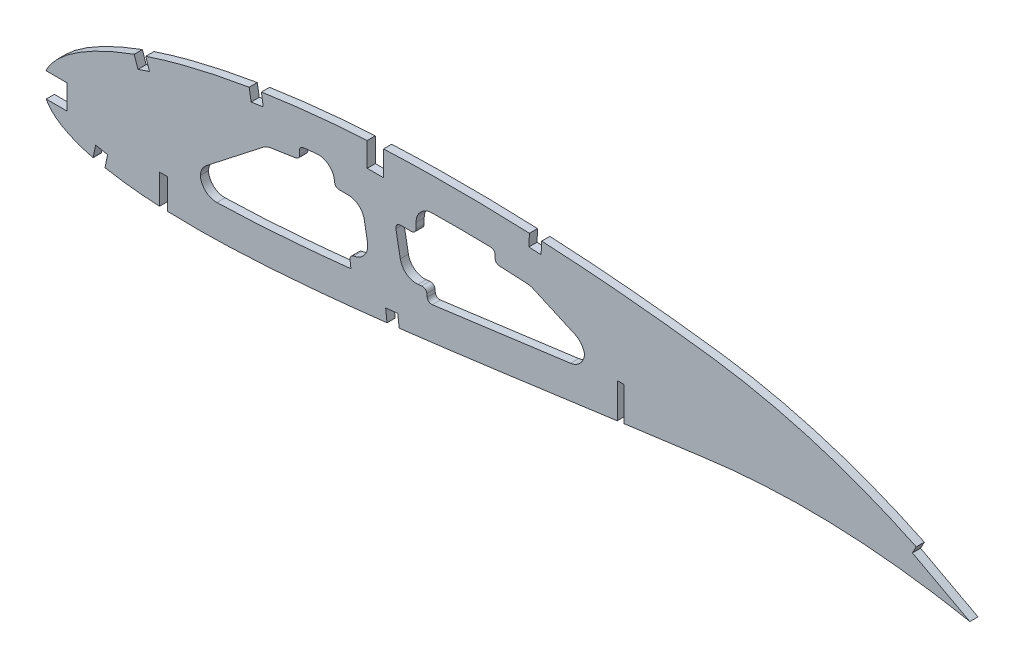
from build123d import *

# Parameters (mm, degrees)
BOSS_EXTRUDE1_DEPTH = 3.175
CUT_EXTRUDE1_DEPTH  = 7.62
SKETCH3_W           = 9.525
SKETCH3_H           = 9.525
CUT_EXTRUDE2_DEPTH  = 7.62
CUT_EXTRUDE3_DEPTH  = 7.62
FILLET1_R           = 6.35
FILLET2_R           = 1.778
CUT_EXTRUDE4_DEPTH  = 374.229172675


with BuildPart() as part:
    # Sketch1 → Boss-Extrude1 (new body)
    with BuildSketch(Plane.XY):
        with BuildLine():
            Line((366.779221984, -0.572532859), (370.310025602, -1.32569148))
            Line((370.310025602, -1.32569148), (367.237248504, 0.572532859))
            add(Edge.make_bspline(
                [(367.237248504, 0.572532859), (367.209115751, 0.589912016), (367.096693954, 0.659361177), (366.843387397, 0.814735964), (366.421579402, 1.073520617), (365.831084917, 1.43391727), (365.072362673, 1.894969327), (364.145030833, 2.453448145), (363.049668235, 3.107539147), (361.78654025, 3.854149183), (360.355776171, 4.689782048), (358.757920825, 5.61105264), (356.993113179, 6.61274511), (355.06203687, 7.690766613), (352.96535437, 8.839989942), (350.703462511, 10.055224806), (348.277171256, 11.330289826), (345.687411743, 12.659700467), (342.934656313, 14.036115757), (340.020202795, 15.453807339), (336.945022097, 16.905706333), (333.710163942, 18.384066929), (330.317486658, 19.882862373), (326.767928213, 21.392774778), (323.06351151, 22.907262237), (319.205813659, 24.417705773), (315.197118609, 25.917225993), (311.038972972, 27.396108947), (306.73448515, 28.847891701), (302.285743308, 30.263143128), (297.695928748, 31.634176974), (292.967708233, 32.952104115), (288.10502333, 34.210165552), (283.11095799, 35.399199558), (277.989744959, 36.511247133), (272.745455003, 37.539613083), (267.382486443, 38.474030655), (261.915700498, 39.313771303), (256.433056518, 40.012293244), (250.961692668, 40.697383276), (245.498477017, 41.34096267), (239.968489428, 41.957278945), (234.377050063, 42.54286215), (228.729705217, 43.095881158), (223.032171983, 43.613949148), (217.290371144, 44.095546934), (211.509858724, 44.537945534), (205.696729956, 44.940463429), (199.8567319, 45.299561873), (193.996084852, 45.614971395), (188.120738144, 45.884492116), (182.236806039, 46.106266996), (176.350536437, 46.278957311), (170.468039484, 46.400908527), (164.595684421, 46.47135392), (158.739579431, 46.488368695), (152.90609078, 46.451648421), (147.101327081, 46.35993231), (141.331661108, 46.21196474), (135.603209819, 46.00746964), (129.92216764, 45.746535631), (124.294754737, 45.426977601), (118.727075839, 45.050831997), (113.22533102, 44.616518763), (107.79556513, 44.123922344), (102.443468619, 43.575096068), (97.175000212, 42.968547242), (91.995806101, 42.306001647), (86.911551284, 41.588758347), (81.927940427, 40.816426555), (77.050312099, 39.991237197), (72.283930644, 39.114034533), (67.633838897, 38.187390229), (63.105099551, 37.211546097), (58.702506527, 36.189429331), (54.430635268, 35.12282073), (50.29407794, 34.013672938), (46.297027813, 32.864647422), (42.443526778, 31.678350961), (38.73806709, 30.456087063), (35.183449271, 29.20248999), (31.784039791, 27.918449689), (28.542442713, 26.607921896), (25.46245696, 25.272695966), (22.546383362, 23.916842473), (19.79752229, 22.541904914), (17.217832841, 21.151735431), (14.809904809, 19.748465709), (12.576056134, 18.334702116), (10.517225629, 16.914030851), (8.636251908, 15.487343527), (6.933781057, 14.058245411), (5.410890546, 12.628912534), (4.069757076, 11.200329631), (2.910332492, 9.775012337), (1.93413617, 8.354089532), (1.141337537, 6.938905699), (0.533729736, 5.530488873), (0.110710257, 4.129631103), (-0.120847754, 2.738400014), (-0.178483964, 1.355680289), (-0.059405759, 0.451218221), (0, 0)],
                knots=[0, 0, 0, 0, 0.00025409, 0.001015374, 0.002283359, 0.004056577, 0.006330982, 0.009105274, 0.01237449, 0.016134024, 0.020379661, 0.025105976, 0.030306237, 0.035972206, 0.042099523, 0.048678064, 0.055701664, 0.063160184, 0.071045824, 0.079349827, 0.08806291, 0.097175757, 0.106678112, 0.116561573, 0.126814276, 0.1374283, 0.148393618, 0.15969976, 0.171338126, 0.183297699, 0.195569604, 0.208143556, 0.221011594, 0.234161831, 0.247587451, 0.261276823, 0.27522271, 0.289414144, 0.3037712, 0.317689227, 0.331784111, 0.346039677, 0.36044387, 0.374982721, 0.389640455, 0.404403317, 0.419256601, 0.43418675, 0.449177265, 0.464214782, 0.479284009, 0.49436974, 0.509457833, 0.524532346, 0.53957932, 0.554582984, 0.569529546, 0.584403417, 0.599190992, 0.613876838, 0.628447475, 0.642888675, 0.657186054, 0.671325546, 0.685294014, 0.699078148, 0.712665095, 0.726042645, 0.739197713, 0.752117587, 0.764792042, 0.777208152, 0.789355685, 0.80122396, 0.812803686, 0.824082909, 0.835054602, 0.845709571, 0.856037853, 0.866033835, 0.875688843, 0.884997719, 0.893953426, 0.902552897, 0.910789386, 0.918660734, 0.926166253, 0.933302626, 0.94007122, 0.94647478, 0.952517526, 0.958204819, 0.963546652, 0.9685566, 0.973249913, 0.977651041, 0.981787043, 0.985694226, 0.989415109, 0.993001157, 0.996508416, 1, 1, 1, 1], degree=3))
            add(Edge.make_bspline(
                [(0, 0), (0.094305225, -0.445183561), (0.283349084, -1.337596664), (0.796956591, -2.622301778), (1.476177967, -3.857275533), (2.335268581, -5.03923752), (3.368516216, -6.167864763), (4.573638936, -7.244331071), (5.949454767, -8.268057766), (7.494163107, -9.238578843), (9.205519965, -10.156924625), (11.08160183, -11.022524069), (13.120698043, -11.835106765), (15.320587008, -12.593586411), (17.678579271, -13.299118217), (20.19243298, -13.949982821), (22.859289626, -14.547089925), (25.676584203, -15.088915361), (28.641246729, -15.576009603), (31.750197347, -16.008099996), (35.00024492, -16.385456897), (38.388200927, -16.707288362), (41.910714326, -16.9742867), (45.564274184, -17.18662904), (49.34533406, -17.344988676), (53.250272092, -17.448763617), (57.275263844, -17.499571714), (61.416671846, -17.498175704), (65.670444823, -17.444202264), (70.032949035, -17.340633073), (74.49999818, -17.186812008), (79.067559409, -16.984600621), (83.731512725, -16.736033793), (88.487675073, -16.441954217), (93.331860865, -16.103665214), (98.259864016, -15.723879754), (103.267207887, -15.30354505), (108.349525408, -14.845111196), (113.502317177, -14.350873178), (118.721131264, -13.822395178), (124.001361141, -13.262163166), (129.338303799, -12.671992621), (134.727419145, -12.055032062), (140.163784234, -11.412397718), (145.642802026, -10.74775877), (151.159318159, -10.062385108), (156.708719705, -9.358916499), (162.286015513, -8.640665313), (167.885984275, -7.907549552), (173.503916032, -7.164792444), (179.134393031, -6.4117822), (184.772514322, -5.652391584), (190.413060751, -4.888980999), (196.050538376, -4.121785421), (201.679991678, -3.353984297), (207.296198332, -2.587685341), (212.893657193, -1.822958656), (218.467304002, -1.063605171), (224.011526297, -0.309532116), (229.521211727, 0.437731721), (234.99108049, 1.175955737), (240.415971972, 1.904208342), (245.79029012, 2.622028682), (251.108627927, 3.329686337), (256.286014622, 4.005702206), (261.308921574, 4.686074193), (266.194275064, 5.243828548), (271.018799677, 5.719891856), (275.78750695, 6.110198164), (280.494670713, 6.420362635), (285.134897569, 6.652601616), (289.702657326, 6.810157431), (294.192180199, 6.897704202), (298.597858723, 6.917463603), (302.913679308, 6.875737092), (307.134028762, 6.775888132), (311.253016964, 6.622398487), (315.264897433, 6.420446666), (319.163971775, 6.175537915), (322.944386272, 5.891284948), (326.600873145, 5.574323732), (330.127790902, 5.229294225), (333.519723856, 4.860138451), (336.771722702, 4.474591735), (339.878582354, 4.075192399), (342.835629531, 3.668504141), (345.638104292, 3.258648226), (348.281568103, 2.850857356), (350.76186785, 2.449021765), (353.074996968, 2.058474907), (355.217332046, 1.682865683), (357.185155535, 1.3258622), (358.975737519, 0.991968888), (360.585541683, 0.682844304), (362.012414965, 0.403582965), (363.253704214, 0.155417071), (364.307589717, -0.058157081), (365.172231074, -0.236296472), (365.846315097, -0.376076876), (366.328510303, -0.477721618), (366.618295084, -0.538205409), (366.747050131, -0.565670254), (366.779221984, -0.572532859)],
                knots=[0, 0, 0, 0, 0.003638255, 0.007293231, 0.011028136, 0.014901081, 0.018963272, 0.023258475, 0.027820626, 0.032679082, 0.03785316, 0.043361875, 0.049214679, 0.055422346, 0.061988786, 0.068918036, 0.076211157, 0.083868392, 0.091887411, 0.100265912, 0.108999867, 0.11808453, 0.127514843, 0.13728527, 0.147387918, 0.157816481, 0.168563473, 0.179619128, 0.190977373, 0.202626974, 0.214560478, 0.226767249, 0.239236417, 0.251959004, 0.264923895, 0.278119703, 0.291536035, 0.30516028, 0.318980685, 0.332985499, 0.347162791, 0.361498603, 0.375980747, 0.390597192, 0.405332594, 0.420174823, 0.435109533, 0.450124276, 0.465203068, 0.480333154, 0.495500583, 0.510689775, 0.525887335, 0.541078314, 0.556247233, 0.571381785, 0.586466041, 0.601484516, 0.616424329, 0.631269423, 0.646006524, 0.660620684, 0.675098187, 0.689422858, 0.703581825, 0.716907564, 0.730009274, 0.742952128, 0.755725558, 0.768319952, 0.780724338, 0.792926529, 0.804916041, 0.816679084, 0.828203524, 0.839474901, 0.850481359, 0.861207697, 0.871639326, 0.881763414, 0.891563605, 0.901027365, 0.910138977, 0.918883977, 0.927249278, 0.935221104, 0.942784739, 0.949928188, 0.956638465, 0.962904204, 0.968712288, 0.974054485, 0.978918432, 0.983297218, 0.987180246, 0.990560675, 0.993433358, 0.995790626, 0.997629588, 0.998945816, 0.999736593, 1, 1, 1, 1], degree=3))
        make_face()
    extrude(amount=BOSS_EXTRUDE1_DEPTH)

    # Sketch2 → Cut-Extrude1 (cut)
    with BuildSketch(Plane(origin=(0, 0, 0), x_dir=(-1, 0, 0), z_dir=(0, 0, -1))):
        Polygon((-226.175879032, 13.224515278), (-223.635879032, 13.224515278), (-223.635879032, 0.034213202), (-223.635879032, -0.783515638), (-226.175879032, -1.601244478), (-226.175879032, 0.034213202), align=None)
        Polygon((-48.375879032, -5.600977173), (-48.375879032, -17.01801887), (-48.375879032, -19.750567379), (-45.200879032, -18.044099627), (-45.200879032, -17.01801887), (-45.200879032, -5.600977173), align=None)
        Polygon((-132.513379032, 45.736898821), (-132.513379032, 36.143993965), (-126.163379032, 36.143993965), (-126.163379032, 45.736898821), (-126.163379032, 46.559990379), (-132.513379032, 48.500789295), align=None)
    extrude(amount=-CUT_EXTRUDE1_DEPTH, mode=Mode.SUBTRACT)

    # Sketch3 → Cut-Extrude2 (cut)
    with BuildSketch(Plane.XY.offset(3.175)):
        with Locations((4.348577792, 1.725398204)):
            Rectangle(SKETCH3_W, SKETCH3_H)
        Polygon((133.895690698, -12.137729329), (134.169531887, -14.470083726), (138.913436023, -13.913103041), (138.639594834, -11.580748644), (138.077073431, -6.844731778), (133.347815951, -7.40644956), align=None)
        Polygon((24.967200522, -9.876953877), (20.306964104, -8.907810929), (19.337454486, -13.571765616), (19.017747374, -14.92080263), (23.649458948, -16.018467939), (23.969166061, -14.669430925), align=None)
        with BuildLine():
            Line((41.321433418, 26.393922119), (39.810632112, 30.906701866))
            add(Edge.make_bspline(
                [(39.810632112, 30.906701866), (39.398873793, 30.769184142), (37.894597652, 30.261329765), (36.396552354, 29.735192442), (35.312007887, 29.342214059)],
                knots=[0, 0, 0, 0, 0.273427544, 1, 1, 1, 1], degree=3))
            Line((35.312007887, 29.342214059), (36.805350121, 24.881965345))
            Line((36.805350121, 24.881965345), (41.321433418, 26.393922119))
        make_face()
        with BuildLine():
            Line((85.624280504, 36.626114416), (84.90230804, 41.335327907))
            add(Edge.make_bspline(
                [(84.90230804, 41.335327907), (83.979718585, 41.193535561), (82.391504761, 40.943503096), (80.804941449, 40.683277808), (80.139800681, 40.572292745)],
                knots=[0, 0, 0, 0, 0.580571145, 1, 1, 1, 1], degree=3))
            Line((80.139800681, 40.572292745), (80.916790896, 35.904396126))
            Line((80.916790896, 35.904396126), (85.624280504, 36.626114416))
        make_face()
        with BuildLine():
            Line((193.941087695, 40.859287578), (194.183326577, 45.61464494))
            ThreePointArc((194.183326577, 45.61464494), (191.789299148, 45.732434347), (189.39491691, 45.842776438))
            Line((189.39491691, 45.842776438), (189.184743938, 41.09971448))
            Line((189.184743938, 41.09971448), (193.941087695, 40.859287578))
        make_face()
    extrude(amount=-CUT_EXTRUDE2_DEPTH, mode=Mode.SUBTRACT)

    # Sketch4 → Cut-Extrude3 (cut)
    with BuildSketch(Plane.XY.offset(3.175)):
        with BuildLine():
            Line((127.502433775, 4.688533857), (124.050451933, 23.443993965))
            Line((124.050451933, 23.443993965), (119.813379032, 23.443993965))
            Line((119.813379032, 23.443993965), (113.463379032, 23.443993965))
            Line((113.463379032, 23.443993965), (113.463379032, 31.879991554))
            add(Edge.make_bspline(
                [(113.463379032, 31.879991554), (112.290638403, 31.778475245), (109.945539571, 31.566326734), (106.432900771, 31.220298755), (102.924350774, 30.845585654), (100.588896046, 30.57621639), (99.421605686, 30.436454104)],
                knots=[0.248834567, 0.248834567, 0.248834567, 0.248834567, 0.377634488, 0.506434408, 0.635234328, 0.764034248, 0.764034248, 0.764034248, 0.764034248], degree=3))
            Line((99.421605686, 30.436454104), (100.102164394, 25.99737033))
            Line((100.102164394, 25.99737033), (86.87267557, 23.969120701))
            Line((86.87267557, 23.969120701), (61.075879032, 3.842208329))
            Line((61.075879032, 3.842208329), (61.075879032, -4.791866551))
            add(Edge.make_bspline(
                [(61.075879032, -4.791866551), (65.955994803, -4.764368164), (75.697637518, -4.495093596), (90.394506419, -3.633462019), (105.09635876, -2.428162799), (114.912631449, -1.453195109), (119.813474869, -0.934204982)],
                knots=[0.088296765, 0.088296765, 0.088296765, 0.088296765, 0.294057357, 0.499817949, 0.70557854, 0.911339132, 0.911339132, 0.911339132, 0.911339132], degree=3))
            Line((119.813474869, -0.934204982), (119.275523193, 3.711382161))
            Line((119.275523193, 3.711382161), (125.562712478, 4.458143367))
            Line((125.562712478, 4.458143367), (127.502433775, 4.688533857))
        make_face()
        with BuildLine():
            Line((149.190511343, 7.264536301), (149.749032187, 2.562201201))
            add(Edge.make_bspline(
                [(149.749032187, 2.562201201), (154.846835269, 3.201913662), (165.034248053, 4.515728791), (180.329199315, 6.558224181), (195.62747188, 8.63587756), (205.833665073, 10.031067282), (210.935879032, 10.727141289)],
                knots=[0.086693034, 0.086693034, 0.086693034, 0.086693034, 0.296227424, 0.505761815, 0.715296205, 0.924830596, 0.924830596, 0.924830596, 0.924830596], degree=3))
            Line((210.935879032, 10.727141289), (210.935879032, 18.871288601))
            Line((210.935879032, 18.871288601), (189.75201488, 28.35482471))
            Line((189.75201488, 28.35482471), (175.938475288, 29.053080913))
            Line((175.938475288, 29.053080913), (176.138710964, 33.571883724))
            add(Edge.make_bspline(
                [(176.138710964, 33.571883724), (173.560613823, 33.636883674), (168.402851468, 33.737321687), (160.669600144, 33.795620714), (152.937961553, 33.758580682), (147.788272062, 33.667462597), (145.213379032, 33.604473367)],
                knots=[0.147373022, 0.147373022, 0.147373022, 0.147373022, 0.325247969, 0.503122917, 0.680997865, 0.858872813, 0.858872813, 0.858872813, 0.858872813], degree=3))
            Line((145.213379032, 33.604473367), (145.213379032, 23.443993965))
            Line((145.213379032, 23.443993965), (136.963767817, 23.443993965))
            Line((136.963767817, 23.443993965), (140.139493462, 6.189501222))
            Line((140.139493462, 6.189501222), (149.190511343, 7.264536301))
        make_face()
    extrude(amount=-CUT_EXTRUDE3_DEPTH, mode=Mode.SUBTRACT)

    # Fillet1
    # the kernel refuses this fillet: 6.35 mm, written as the material it adds along each edge
    with BuildSketch(Plane(origin=(210.935879032, 10.727141289, 3.175), x_dir=(-0.9908129389380453, -0.13523949139564623, 0), z_dir=(0, 0, -1))) as fillet1_piece_1:
        with BuildLine():
            CenterArc((5.542145257, 6.349999996), FILLET1_R, 187.772468739, 82.2254658)
            Line((-0.749516905, 5.491229226), (-0.875350148, 5.47405381))
            Line((-0.875350148, 5.47405381), (-0.125833243, -0.017175415))
            Line((-0.125833243, -0.017175415), (8.427e-06, -0.127))
            ThreePointArc((8.427e-06, -0.127), (2.770957211, -0.126929064), (5.541911767, -0.127))
            Line((5.541911767, -0.127), (5.541916345, 0))
        make_face()
    fillet1_piece_1_solid = extrude(amount=3.175, mode=Mode.PRIVATE)
    with BuildSketch(Plane(origin=(210.935879032, 18.871288601, 3.175), x_dir=(0, -1, 0), z_dir=(0, 0, -1))) as fillet1_piece_2:
        with BuildLine():
            CenterArc((FILLET1_R * 0.647957175383, FILLET1_R), FILLET1_R, 204.116981242, 65.883018758)
            Line((-FILLET1_R * 0.264755941357, FILLET1_R * 0.591399013059), (-FILLET1_R * 0.283010203692, FILLET1_R * 0.58322699332))
            Line((-FILLET1_R * 0.283010203692, FILLET1_R * 0.58322699332), (-FILLET1_R * 0.0129591435077, -FILLET1_R * 0.02))
            Line((-FILLET1_R * 0.0129591435077, -FILLET1_R * 0.02), (FILLET1_R * 0.647957175383, -FILLET1_R * 0.02))
            Line((FILLET1_R * 0.647957175383, -FILLET1_R * 0.02), (FILLET1_R * 0.647957175383, 0))
        make_face()
    fillet1_piece_2_solid = extrude(amount=3.175, mode=Mode.PRIVATE)
    with BuildSketch(Plane(origin=(189.75201488, 28.35482471, 3.175), x_dir=(0.9127131167407931, -0.4086009869411811, 0), z_dir=(0, 0, -1))) as fillet1_piece_3:
        with BuildLine():
            CenterArc((FILLET1_R * 0.187354634324, FILLET1_R), FILLET1_R, 248.776781818, 21.223218182)
            Line((-FILLET1_R * 0.174647715097, FILLET1_R * 0.0678228178003), (-FILLET1_R * 0.181887762085, FILLET1_R * 0.0491792741563))
            Line((-FILLET1_R * 0.181887762085, FILLET1_R * 0.0491792741563), (-FILLET1_R * 0.00374709268649, -FILLET1_R * 0.02))
            Line((-FILLET1_R * 0.00374709268649, -FILLET1_R * 0.02), (FILLET1_R * 0.187354634324, -FILLET1_R * 0.02))
            Line((FILLET1_R * 0.187354634324, -FILLET1_R * 0.02), (FILLET1_R * 0.187354634324, 0))
        make_face()
    fillet1_piece_3_solid = extrude(amount=3.175, mode=Mode.PRIVATE)
    with BuildSketch(Plane(origin=(140.139493462, 6.189501222, 3.175), x_dir=(-0.18101173288940534, 0.9834809365495473, 0), z_dir=(0, 0, -1))) as fillet1_piece_4:
        with BuildLine():
            CenterArc((FILLET1_R * 0.938157713111, FILLET1_R), FILLET1_R, 183.655120797, 86.344879203)
            Line((-FILLET1_R * 0.0598081465259, FILLET1_R * 0.93624936864), (-FILLET1_R * 0.0797674637187, FILLET1_R * 0.934974356013))
            Line((-FILLET1_R * 0.0797674637187, FILLET1_R * 0.934974356013), (-FILLET1_R * 0.0187631542622, -FILLET1_R * 0.02))
            Line((-FILLET1_R * 0.0187631542622, -FILLET1_R * 0.02), (FILLET1_R * 0.938157713111, -FILLET1_R * 0.02))
            Line((FILLET1_R * 0.938157713111, -FILLET1_R * 0.02), (FILLET1_R * 0.938157713111, 0))
        make_face()
    fillet1_piece_4_solid = extrude(amount=3.175, mode=Mode.PRIVATE)
    with BuildSketch(Plane(origin=(145.213379032, 33.604473367, 3.175), x_dir=(0.9998187254385299, 0.01903985983334144, 0), z_dir=(0, 0, -1))) as fillet1_piece_5:
        with BuildLine():
            CenterArc((6.230228001, 6.349909176), FILLET1_R, 181.090969533, 89.215474752)
            Line((-0.118620905, 6.229006066), (-0.245597883, 6.226588004))
            Line((-0.245597883, 6.226588004), (-0.126976978, -0.002418062))
            Line((-0.126976978, -0.002418062), (-0.000687951, -0.126998137))
            ThreePointArc((-0.000687951, -0.126998137), (3.132097605, -0.135430111), (6.264869823, -0.126998184))
            Line((6.264869823, -0.126998184), (6.264190571, 0))
        make_face()
    fillet1_piece_5_solid = extrude(amount=3.175, mode=Mode.PRIVATE)
    with BuildSketch(Plane(origin=(113.463379032, 31.879991554, 3.175), x_dir=(0, -1, 0), z_dir=(0, 0, -1))) as fillet1_piece_6:
        with BuildLine():
            CenterArc((6.978060998, 6.35), FILLET1_R, 174.143248223, 95.856751777)
            Line((0.66120721, 6.997964681), (0.534870134, 7.010923975))
            ThreePointArc((0.534870134, 7.010923975), (0.190283078, 3.512235041), (-0.126526839, 0.010952582))
            Line((-0.126526839, 0.010952582), (0, -0.127))
            Line((0, -0.127), (6.978060998, -0.127))
            Line((6.978060998, -0.127), (6.978060998, 0))
        make_face()
    fillet1_piece_6_solid = extrude(amount=3.175, mode=Mode.PRIVATE)
    with BuildSketch(Plane(origin=(124.050451933, 23.443993965, 3.175), x_dir=(0.18101173288940445, -0.9834809365495474, 0), z_dir=(0, 0, -1))) as fillet1_piece_7:
        with BuildLine():
            CenterArc((FILLET1_R * 0.832744425107, FILLET1_R), FILLET1_R, 190.428695923, 79.571304077)
            Line((-FILLET1_R * 0.150736511443, FILLET1_R * 0.818988267111), (-FILLET1_R * 0.170406130174, FILLET1_R * 0.815368032453))
            Line((-FILLET1_R * 0.170406130174, FILLET1_R * 0.815368032453), (-FILLET1_R * 0.0166548885021, -FILLET1_R * 0.02))
            Line((-FILLET1_R * 0.0166548885021, -FILLET1_R * 0.02), (FILLET1_R * 0.832744425107, -FILLET1_R * 0.02))
            Line((FILLET1_R * 0.832744425107, -FILLET1_R * 0.02), (FILLET1_R * 0.832744425107, 0))
        make_face()
    fillet1_piece_7_solid = extrude(amount=3.175, mode=Mode.PRIVATE)
    with BuildSketch(Plane(origin=(127.502433775, 4.688533857, 3.175), x_dir=(-0.1810117328894044, 0.9834809365495475, 0), z_dir=(0, 0, -1))) as fillet1_piece_8:
        with BuildLine():
            CenterArc((FILLET1_R * 1.06591885994, -FILLET1_R), FILLET1_R, 90, 93.655120797)
            Line((FILLET1_R * 0.0679530002993, -FILLET1_R * 1.06375063136), (FILLET1_R * 0.0479936831066, -FILLET1_R * 1.06502564399))
            Line((FILLET1_R * 0.0479936831066, -FILLET1_R * 1.06502564399), (-FILLET1_R * 0.0213183771987, FILLET1_R * 0.02))
            Line((-FILLET1_R * 0.0213183771987, FILLET1_R * 0.02), (FILLET1_R * 1.06591885994, FILLET1_R * 0.02))
            Line((FILLET1_R * 1.06591885994, FILLET1_R * 0.02), (FILLET1_R * 1.06591885994, 0))
        make_face()
    fillet1_piece_8_solid = extrude(amount=3.175, mode=Mode.PRIVATE)
    with BuildSketch(Plane(origin=(86.87267557, 23.969120701, 3.175), x_dir=(0.9884507988139054, 0.15154213382473017, 0), z_dir=(0, 0, -1))) as fillet1_piece_9:
        with BuildLine():
            CenterArc((FILLET1_R * 0.260903569055, FILLET1_R), FILLET1_R, 240.754603776, 29.245396224)
            Line((-FILLET1_R * 0.227647564892, FILLET1_R * 0.127464734513), (-FILLET1_R * 0.237418587571, FILLET1_R * 0.110014029203))
            Line((-FILLET1_R * 0.237418587571, FILLET1_R * 0.110014029203), (-FILLET1_R * 0.0052180713811, -FILLET1_R * 0.02))
            Line((-FILLET1_R * 0.0052180713811, -FILLET1_R * 0.02), (FILLET1_R * 0.260903569055, -FILLET1_R * 0.02))
            Line((FILLET1_R * 0.260903569055, -FILLET1_R * 0.02), (FILLET1_R * 0.260903569055, 0))
        make_face()
    fillet1_piece_9_solid = extrude(amount=3.175, mode=Mode.PRIVATE)
    with BuildSketch(Plane(origin=(61.075879032, 3.842208329, 3.175), x_dir=(0.7884220988432111, 0.6151346145809596, 0), z_dir=(0, 0, -1))) as fillet1_piece_10:
        with BuildLine():
            CenterArc((FILLET1_R * 0.488146369798, FILLET1_R), FILLET1_R, 217.961702275, 52.038297725)
            Line((-FILLET1_R * 0.300275729045, FILLET1_R * 0.384865385419), (-FILLET1_R * 0.316044171022, FILLET1_R * 0.372562693127))
            Line((-FILLET1_R * 0.316044171022, FILLET1_R * 0.372562693127), (-FILLET1_R * 0.00976292739597, -FILLET1_R * 0.02))
            Line((-FILLET1_R * 0.00976292739597, -FILLET1_R * 0.02), (FILLET1_R * 0.488146369798, -FILLET1_R * 0.02))
            Line((FILLET1_R * 0.488146369798, -FILLET1_R * 0.02), (FILLET1_R * 0.488146369798, 0))
        make_face()
    fillet1_piece_10_solid = extrude(amount=3.175, mode=Mode.PRIVATE)
    with BuildSketch(Plane(origin=(61.075879032, -4.791866551, 3.175), x_dir=(0, 1, 0), z_dir=(0, 0, -1))) as fillet1_piece_11:
        with BuildLine():
            CenterArc((6.445593567, 6.35), FILLET1_R, 178.630054344, 91.369945656)
            Line((0.0974086, 6.501814429), (-0.0295551, 6.504850718))
            ThreePointArc((-0.0295551, 6.504850718), (-0.093136915, 3.253047023), (-0.126997984, 0.000715606))
            Line((-0.126997984, 0.000715606), (0, -0.127))
            Line((0, -0.127), (6.445593567, -0.127))
            Line((6.445593567, -0.127), (6.445593567, 0))
        make_face()
    fillet1_piece_11_solid = extrude(amount=3.175, mode=Mode.PRIVATE)
    add([fillet1_piece_1_solid, fillet1_piece_2_solid, fillet1_piece_3_solid, fillet1_piece_4_solid, fillet1_piece_5_solid, fillet1_piece_6_solid, fillet1_piece_7_solid, fillet1_piece_8_solid, fillet1_piece_9_solid, fillet1_piece_10_solid, fillet1_piece_11_solid])

    # Fillet2
    fillet2_edges = [part.edges().sort_by_distance(p)[0] for p in [
        (175.938475288, 29.053080913, 1.5875),
        (176.138710964, 33.571883724, 1.5875),
        (145.213379032, 23.443993965, 1.5875),
        (136.963767817, 23.443993965, 1.5875),
        (149.749032187, 2.562201201, 1.5875),
        (149.190511343, 7.264536301, 1.5875),
        (119.275523193, 3.711382161, 1.5875),
        (113.463379032, 23.443993965, 1.5875),
        (99.421605686, 30.436454104, 1.5875),
        (100.102164394, 25.99737033, 1.5875),
    ]]
    fillet(fillet2_edges, radius=FILLET2_R)

    # Sketch5 → Cut-Extrude4 (cut, through all)
    with BuildSketch(Plane.XY.offset(3.175)):
        Polygon((340.184301534, 15.367962462), (338.686408537, 12.568508664), (361.082038923, 0.585364685), (362.57993192, 3.384818484), align=None)
    extrude(amount=-CUT_EXTRUDE4_DEPTH, mode=Mode.SUBTRACT)


with BuildPart() as cut_extrude4_kept_piece:
    # of the separate pieces the step leaves, the one the design keeps (cut_extrude4_pieces_kept)
    add(part.part.solids().sort_by_distance((223.635879032, 13.224515278, 3.175))[0])


solid = cut_extrude4_kept_piece.part
